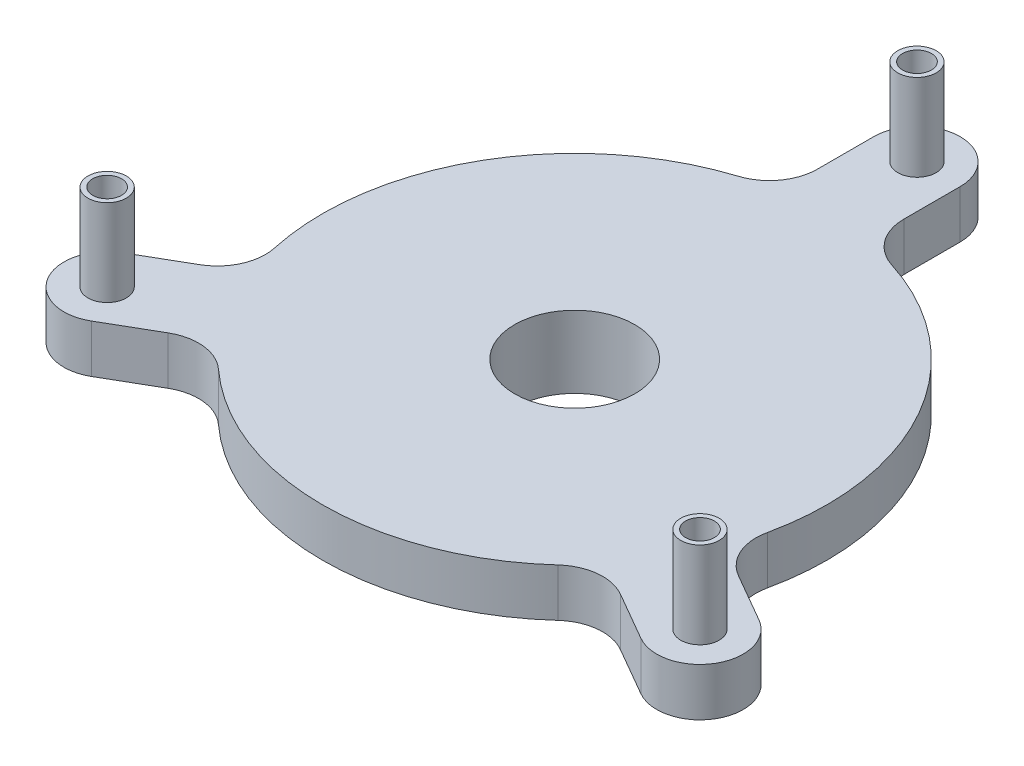
from build123d import *
from build123d.topology import SkipClean

# Parameters (mm, degrees)
SKETCH_1_R               = 82.5
SKETCH_1_R_2             = 12.5
EXTRUDE_1_DEPTH          = 5
SKETCH_2_R               = 4
SKETCH_2_R_2             = 3
EXTRUDE_2_DEPTH          = 18
EXTRUDE_START            = 5
SKETCH_3_R               = 35
SKETCH_3_R_2             = 12.5
EXTRUDE_3_DEPTH          = 5
CUT_EXTRUDE_1_DEPTH      = 119.05295422
CUT_EXTRUDE_1_DEPTH_BACK = 10
SKETCH_4_R               = 82.5
EXTRUDE_4_DEPTH          = 5
SKETCH_6_R               = 12.5
CUT_EXTRUDE_2_DEPTH      = 110.399094856
SKETCH_7_R               = 34.75
SKETCH_7_R_2             = 12.5
EXTRUDE_5_DEPTH          = 5


with BuildPart() as part:
    # 草圖1 → 填料-伸長1 (new body)
    with BuildSketch(Plane(origin=(0, 0, 0), x_dir=(1, 0, 0), z_dir=(0, 1, 0))):
        with Locations(Location((0, 0, 0), (0, 0, 270))):
            Circle(SKETCH_1_R)
        with Locations(Location((0, 0, 0), (0, 0, 270))):
            Circle(SKETCH_1_R_2, mode=Mode.SUBTRACT)
    extrude(amount=EXTRUDE_1_DEPTH)

    # 草圖2 → 填料-伸長2 (add)
    # profile 1 of 3: a face of its own
    with BuildSketch(Plane(origin=(0, 5, 0), x_dir=(1, 0, 0), z_dir=(0, 1, 0))):
        with Locations(Location((0, 71.25, 0), (0, 0, 270))):
            Circle(SKETCH_2_R)
        with Locations(Location((0, 71.25, 0), (0, 0, 270))):
            Circle(SKETCH_2_R_2, mode=Mode.SUBTRACT)
    # profile 2 of 3: a face of its own
    with BuildSketch(Plane(origin=(0, 5, 0), x_dir=(1, 0, 0), z_dir=(0, 1, 0))):
        with Locations(Location((61.70431002, -35.625, 0), (0, 0, 270))):
            Circle(SKETCH_2_R)
        with Locations(Location((61.70431002, -35.625, 0), (0, 0, 270))):
            Circle(SKETCH_2_R_2, mode=Mode.SUBTRACT)
    # profile 3 of 3: a face of its own
    with BuildSketch(Plane(origin=(0, 5, 0), x_dir=(1, 0, 0), z_dir=(0, 1, 0))):
        with Locations(Location((-61.70431002, -35.625, 0), (0, 0, 270))):
            Circle(SKETCH_2_R)
        with Locations(Location((-61.70431002, -35.625, 0), (0, 0, 270))):
            Circle(SKETCH_2_R_2, mode=Mode.SUBTRACT)
    extrude(amount=EXTRUDE_2_DEPTH)

    # 草圖3 → 填料-伸長3 (add)
    with SkipClean():  # the faces are left unmerged after this step: merging them gives an invalid solid
        with BuildSketch(Plane.XZ.offset(EXTRUDE_START)):
            with Locations(Location((0, 0, 0), (0, 0, 90))):
                Circle(SKETCH_3_R)
            with Locations(Location((0, 0, 0), (0, 0, 270))):
                Circle(SKETCH_3_R_2, mode=Mode.SUBTRACT)
        extrude(amount=-EXTRUDE_3_DEPTH)

    # 草圖4 → 除料-伸長1 (cut, two sides: drawn at the far end of the back side and taken through both)
    with SkipClean():  # the faces are left unmerged after this step: merging them gives an invalid solid
        with BuildSketch(Plane(origin=(0, 5, 0), x_dir=(1, 0, 0), z_dir=(0, 1, 0)).offset(-CUT_EXTRUDE_1_DEPTH_BACK)):
            Circle(SKETCH_4_R)
            with BuildLine():
                ThreePointArc((-35.334504499, -38.829406277), (0, -52.5), (35.334504499, -38.829406277))
                ThreePointArc((35.334504499, -38.829406277), (40.993396246, -36.283053927), (47.064886308, -37.565229625))
                Line((47.064886308, -37.565229625), (57.20431002, -43.419228634))
                ThreePointArc((57.20431002, -43.419228634), (69.498538654, -40.125), (66.20431002, -27.830771366))
                Line((66.20431002, -27.830771366), (56.064886308, -21.976772357))
                ThreePointArc((56.064886308, -21.976772357), (51.918744551, -17.359795573), (51.294504499, -11.185875388))
                ThreePointArc((51.294504499, -11.185875388), (45.466333699, 26.25), (15.96, 50.015281665))
                ThreePointArc((15.96, 50.015281665), (10.925348305, 53.6428495), (9, 59.542001982))
                Line((9, 59.542001982), (9, 71.25))
                ThreePointArc((9, 71.25), (0, 80.25), (-9, 71.25))
                Line((-9, 71.25), (-9, 59.542001982))
                ThreePointArc((-9, 59.542001982), (-10.925348305, 53.6428495), (-15.96, 50.015281665))
                ThreePointArc((-15.96, 50.015281665), (-45.466333699, 26.25), (-51.294504499, -11.185875388))
                ThreePointArc((-51.294504499, -11.185875388), (-51.918744551, -17.359795573), (-56.064886308, -21.976772357))
                Line((-56.064886308, -21.976772357), (-66.20431002, -27.830771366))
                ThreePointArc((-66.20431002, -27.830771366), (-69.498538654, -40.125), (-57.20431002, -43.419228634))
                Line((-57.20431002, -43.419228634), (-47.064886308, -37.565229625))
                ThreePointArc((-47.064886308, -37.565229625), (-40.993396246, -36.283053927), (-35.334504499, -38.829406277))
            make_face(mode=Mode.SUBTRACT)
        extrude(amount=CUT_EXTRUDE_1_DEPTH + CUT_EXTRUDE_1_DEPTH_BACK, mode=Mode.SUBTRACT)

    # 草圖5 → 填料-伸長4 (add)
    with BuildSketch(Plane.XZ):
        with BuildLine():
            Line((-47.064886308, 37.565229625), (-57.20431002, 43.419228634))
            ThreePointArc((-57.20431002, 43.419228634), (-69.498538654, 40.125), (-66.20431002, 27.830771366))
            Line((-66.20431002, 27.830771366), (-56.064886308, 21.976772357))
            ThreePointArc((-56.064886308, 21.976772357), (-51.918744551, 17.359795573), (-51.294504499, 11.185875388))
            ThreePointArc((-51.294504499, 11.185875388), (-45.466333699, -26.25), (-15.96, -50.015281665))
            ThreePointArc((-15.96, -50.015281665), (-10.925348305, -53.6428495), (-9, -59.542001982))
            Line((-9, -59.542001982), (-9, -71.25))
            ThreePointArc((-9, -71.25), (0, -80.25), (9, -71.25))
            Line((9, -71.25), (9, -59.542001982))
            ThreePointArc((9, -59.542001982), (10.925348305, -53.6428495), (15.96, -50.015281665))
            ThreePointArc((15.96, -50.015281665), (45.466333699, -26.25), (51.294504499, 11.185875388))
            ThreePointArc((51.294504499, 11.185875388), (51.918744551, 17.359795573), (56.064886308, 21.976772357))
            Line((56.064886308, 21.976772357), (66.20431002, 27.830771366))
            ThreePointArc((66.20431002, 27.830771366), (69.498538654, 40.125), (57.20431002, 43.419228634))
            Line((57.20431002, 43.419228634), (47.064886308, 37.565229625))
            ThreePointArc((47.064886308, 37.565229625), (40.993396246, 36.283053927), (35.334504499, 38.829406277))
            ThreePointArc((35.334504499, 38.829406277), (0, 52.5), (-35.334504499, 38.829406277))
            ThreePointArc((-35.334504499, 38.829406277), (-40.993396246, 36.283053927), (-47.064886308, 37.565229625))
        make_face()
    extrude(amount=EXTRUDE_4_DEPTH)

    # 草圖6 → 除料-伸長2 (cut, through all)
    with BuildSketch(Plane(origin=(0, 0, 0), x_dir=(1, 0, 0), z_dir=(0, 1, 0))):
        with Locations(Location((0, 0, 0), (0, 0, 270))):
            Circle(SKETCH_6_R)
    extrude(amount=-CUT_EXTRUDE_2_DEPTH, mode=Mode.SUBTRACT)

    # 草圖7 → 填料-伸長5 (add)
    with SkipClean():  # the faces are left unmerged after this step: merging them gives an invalid solid
        with BuildSketch(Plane.XZ.offset(5)):
            with Locations(Location((0, 0, 0), (0, 0, 270))):
                Circle(SKETCH_7_R)
            with Locations(Location((0, 0, 0), (0, 0, 270))):
                Circle(SKETCH_7_R_2, mode=Mode.SUBTRACT)
        extrude(amount=EXTRUDE_5_DEPTH)
    add(part.part.scale(1), mode=Mode.REPLACE)  # the faces are merged on a copy


solid = part.part
